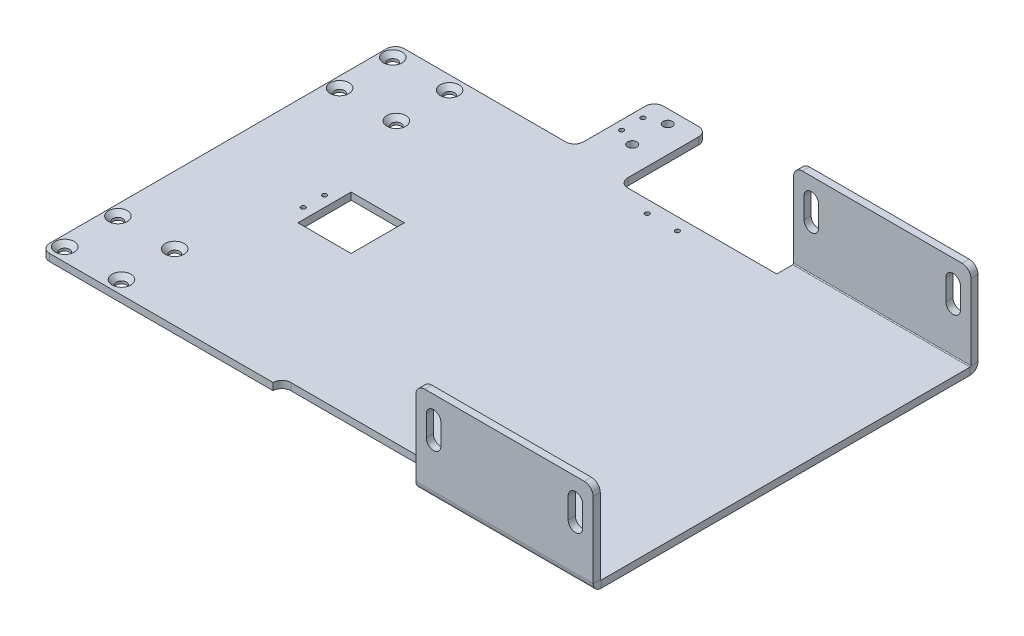
from build123d import *

# Parameters (mm, degrees)
SKETCH_1_W                  = 320
SKETCH_1_H                  = 200
SM_BASE_FLANGE_1_DEPTH      = 4
HOLE_WIZARD_1_AT_2_COUNT    = 2
HOLE_WIZARD_1_AT_2_PITCH    = 30
HOLE_WIZARD_1_AT_3_COUNT    = 2
HOLE_WIZARD_1_AT_3_PITCH    = 43.863424399
HOLE_WIZARD_1_AT_4_COUNT    = 2
HOLE_WIZARD_1_AT_4_PITCH    = 32
HOLE_WIZARD_1_AT_5_COUNT    = 2
HOLE_WIZARD_1_AT_5_PITCH    = 129.031004026
HOLE_WIZARD_1_AT_6_COUNT    = 2
HOLE_WIZARD_1_AT_6_PITCH    = 125
HOLE_WIZARD_1_AT_7_COUNT    = 2
HOLE_WIZARD_1_AT_7_PITCH    = 158.268758762
HOLE_WIZARD_1_AT_8_COUNT    = 2
HOLE_WIZARD_1_AT_8_PITCH    = 155
SKETCH_9_W                  = 30
SKETCH_9_H                  = 45
SM_BASE_FLANGE_1_2_DEPTH    = 4
SKETCH_27_W                 = 89
SKETCH_27_H                 = 5
CUT_EXTRUDE_2_DEPTH         = 216.965274987
SM_EDGE_FLANGE_1_DEPTH      = 100
SM_EDGE_FLANGE_1_BEND_DEPTH = 100
HOLE_START                  = -108.5
HOLE_WIZARD_8_2_8_2_1_DEPTH = 217
F_5_2_5_2_DIAMETER_HOLE1_D  = 5.2
CUT_EXTRUDE_1_REACH         = 223.199
SKETCH_21_W                 = 30
SKETCH_21_H                 = 30
HOLE_WIZARD_M3_2_D          = 2.5
OTHER_START                 = -108.5
OTHER_1_DEPTH               = 217
OTHER_START_2               = -4
OTHER_2_DEPTH               = 4
OTHER_2_2_DEPTH             = 4
HOLE_WIZARD_M3_1_D          = 2.5
HOLE_WIZARD_M3_3_D          = 2.5


# Read off the part's stored shape, not the designer's step: Ø8.2 (8.2) 直径槽口1, 断开-边角1, 断开-边角2
# Sheet-metal steps are written as plain solids
with BuildPart() as part:
    # Sketch 1 → Sm Base Flange 1 (new body)
    with BuildSketch(Plane(origin=(0, 0, 0), x_dir=(1, 0, 0), z_dir=(0, 1, 0))):
        Rectangle(SKETCH_1_W, SKETCH_1_H)
    extrude(amount=-SM_BASE_FLANGE_1_DEPTH)

    # 草图7 → 打孔尺寸开槽半沉头螺钉的类型1 (revolve, cut)
    with BuildSketch(Plane(origin=(-154, 0, 62.5), x_dir=(0, 0, 1), z_dir=(1, 0, 0))):
        Polygon((0, 0), (0, 4), (2.75, 4), (2.75, 2.55), (5.3, 0), align=None)
    hole_wizard_1 = revolve(axis=Axis((-154, 6.35, 62.5), (0, -1, 0)), mode=Mode.SUBTRACT)

    # 打孔尺寸开槽半沉头螺钉的类型1 at 2: 打孔尺寸开槽半沉头螺钉的类型1 ×2
    with Locations(*[(0, 0, i * HOLE_WIZARD_1_AT_2_PITCH) for i in range(1, HOLE_WIZARD_1_AT_2_COUNT)]):
        add(hole_wizard_1, mode=Mode.SUBTRACT)

    # 打孔尺寸开槽半沉头螺钉的类型1 at 3: 打孔尺寸开槽半沉头螺钉的类型1 ×2
    with Locations(*[Vector(0.7295372041400852, 0, 0.6839411288813297) * (i * HOLE_WIZARD_1_AT_3_PITCH) for i in range(1, HOLE_WIZARD_1_AT_3_COUNT)]):
        add(hole_wizard_1, mode=Mode.SUBTRACT)

    # 打孔尺寸开槽半沉头螺钉的类型1 at 4: 打孔尺寸开槽半沉头螺钉的类型1 ×2
    with Locations(*[(i * HOLE_WIZARD_1_AT_4_PITCH, 0, 0) for i in range(1, HOLE_WIZARD_1_AT_4_COUNT)]):
        add(hole_wizard_1, mode=Mode.SUBTRACT)

    # 打孔尺寸开槽半沉头螺钉的类型1 at 5: 打孔尺寸开槽半沉头螺钉的类型1 ×2
    with Locations(*[Vector(0.24800241028513723, 0, -0.9687594151763185) * (i * HOLE_WIZARD_1_AT_5_PITCH) for i in range(1, HOLE_WIZARD_1_AT_5_COUNT)]):
        add(hole_wizard_1, mode=Mode.SUBTRACT)

    # 打孔尺寸开槽半沉头螺钉的类型1 at 6: 打孔尺寸开槽半沉头螺钉的类型1 ×2
    with Locations(*[(0, 0, -i * HOLE_WIZARD_1_AT_6_PITCH) for i in range(1, HOLE_WIZARD_1_AT_6_COUNT)]):
        add(hole_wizard_1, mode=Mode.SUBTRACT)

    # 打孔尺寸开槽半沉头螺钉的类型1 at 7: 打孔尺寸开槽半沉头螺钉的类型1 ×2
    with Locations(*[Vector(0.20218772327747656, 0, -0.979346784625278) * (i * HOLE_WIZARD_1_AT_7_PITCH) for i in range(1, HOLE_WIZARD_1_AT_7_COUNT)]):
        add(hole_wizard_1, mode=Mode.SUBTRACT)

    # 打孔尺寸开槽半沉头螺钉的类型1 at 8: 打孔尺寸开槽半沉头螺钉的类型1 ×2
    with Locations(*[(0, 0, -i * HOLE_WIZARD_1_AT_8_PITCH) for i in range(1, HOLE_WIZARD_1_AT_8_COUNT)]):
        add(hole_wizard_1, mode=Mode.SUBTRACT)

    # 草图9 → Sm Base Flange 1 2 (add)
    with BuildSketch(Plane(origin=(0, 0, 0), x_dir=(1, 0, 0), z_dir=(0, 1, 0))):
        with Locations((-44, 122.5)):
            Rectangle(SKETCH_9_W, SKETCH_9_H)
    extrude(amount=-SM_BASE_FLANGE_1_2_DEPTH)

    # 草图27 → 切除-拉伸2 (cut, through all)
    with BuildSketch(Plane(origin=(0, 0, 0), x_dir=(1, 0, 0), z_dir=(0, 1, 0))):
        with Locations((15.5, 97.5)):
            Rectangle(SKETCH_27_W, SKETCH_27_H)
        with Locations((15.5, -97.5)):
            Rectangle(SKETCH_27_W, SKETCH_27_H)
    extrude(amount=-CUT_EXTRUDE_2_DEPTH, mode=Mode.SUBTRACT)

    # 边线-法兰1 section (across the edge) → 边线-法兰1 (add)
    with BuildSketch(Plane(origin=(60, 0, 104.5), x_dir=(0, 0, -1), z_dir=(1, 0, 0))):
        with BuildLine():
            Line((-4, 0.5), (-4, 48))
            Line((-4, 48), (0, 48))
            Line((0, 48), (0, 0.5))
            ThreePointArc((0, 0.5), (0.146446609, 0.146446609), (0.5, 0))
            Line((0.5, 0), (4.5, 0))
            Line((4.5, 0), (4.5, -4))
            Line((4.5, -4), (0.5, -4))
            ThreePointArc((0.5, -4), (-2.681980515, -2.681980515), (-4, 0.5))
        make_face()
    extrude(amount=SM_EDGE_FLANGE_1_DEPTH)

    # 边线-法兰1 section 2 (across the edge) → 边线-法兰1 bend (add)
    with BuildSketch(Plane(origin=(160, 0, -104.5), x_dir=(0, 0, 1), z_dir=(-1, 0, 0))):
        with BuildLine():
            Line((-4, 0.5), (-4, 48))
            Line((-4, 48), (0, 48))
            Line((0, 48), (0, 0.5))
            ThreePointArc((0, 0.5), (0.146446609, 0.146446609), (0.5, 0))
            Line((0.5, 0), (4.5, 0))
            Line((4.5, 0), (4.5, -4))
            Line((4.5, -4), (0.5, -4))
            ThreePointArc((0.5, -4), (-2.681980515, -2.681980515), (-4, 0.5))
        make_face()
    extrude(amount=SM_EDGE_FLANGE_1_BEND_DEPTH)

    # Ø8.2 (8.2) 直径槽口1 outline → Ø8.2 (8.2) 直径槽口1 (cut)
    with BuildSketch(Plane.XY.offset(HOLE_START)):
        with BuildLine():
            ThreePointArc((145.9, 24.6), (150, 20.5), (154.1, 24.6))
            Line((154.1, 24.6), (154.1, 36.4))
            ThreePointArc((154.1, 36.4), (150, 40.5), (145.9, 36.4))
            Line((145.9, 36.4), (145.9, 24.6))
        make_face()
        with BuildLine():
            ThreePointArc((65.9, 24.6), (70, 20.5), (74.1, 24.6))
            Line((74.1, 24.6), (74.1, 36.4))
            ThreePointArc((74.1, 36.4), (70, 40.5), (65.9, 36.4))
            Line((65.9, 36.4), (65.9, 24.6))
        make_face()
    extrude(amount=HOLE_WIZARD_8_2_8_2_1_DEPTH, mode=Mode.SUBTRACT)

    # Ø5.2 (5.2) Diameter Hole1 (through all)
    with Locations(Plane(origin=(0, 0, 0), x_dir=(1, 0, 0), z_dir=(0, 1, 0))):
        with Locations((-44, 117.5), (-44, 137.5)):
            Hole(F_5_2_5_2_DIAMETER_HOLE1_D / 2)

    # 草图21 → 切除-拉伸1 (cut, up to next)
    with BuildSketch(Plane(origin=(0, 0, 0), x_dir=(1, 0, 0), z_dir=(0, 1, 0)), mode=Mode.PRIVATE) as cut_extrude_1_sk1:
        with Locations((-85, 0)):
            Rectangle(SKETCH_21_W, SKETCH_21_H)
    cut_extrude_1_tool1 = extrude(cut_extrude_1_sk1.sketch, amount=-CUT_EXTRUDE_1_REACH, mode=Mode.PRIVATE) & part.part
    add(cut_extrude_1_tool1.solids().sort_by_distance((-85, 0, 0))[0], mode=Mode.SUBTRACT)

    # M3 螺纹孔2 (through all)
    with Locations(Plane(origin=(0, 0, 0), x_dir=(1, 0, 0), z_dir=(0, 1, 0))):
        with Locations((-106, 6), (-106, -6)):
            Hole(HOLE_WIZARD_M3_2_D / 2)

    # Other 1 outline → Other 1 (cut)
    with BuildSketch(Plane.XY.offset(OTHER_START)):
        with BuildLine():
            ThreePointArc((60, 43), (61.464466094, 46.535533906), (65, 48))
            Line((65, 48), (60, 48))
            Line((60, 48), (60, 43))
        make_face()
        with BuildLine():
            ThreePointArc((155, 48), (158.535533906, 46.535533906), (160, 43))
            Line((160, 43), (160, 48))
            Line((160, 48), (155, 48))
        make_face()
    extrude(amount=OTHER_1_DEPTH, mode=Mode.SUBTRACT)

    # Other 2 outline → Other 2 (cut)
    with BuildSketch(Plane(origin=(0, 0, 0), x_dir=(1, 0, 0), z_dir=(0, 1, 0)).offset(OTHER_START_2)):
        with BuildLine():
            Line((-29, 145), (-34, 145))
            ThreePointArc((-34, 145), (-30.464466094, 143.535533906), (-29, 140))
            Line((-29, 140), (-29, 145))
        make_face()
        with BuildLine():
            Line((-59, 145), (-59, 140))
            ThreePointArc((-59, 140), (-57.535533906, 143.535533906), (-54, 145))
            Line((-54, 145), (-59, 145))
        make_face()
        with BuildLine():
            Line((-160, 100), (-160, 95))
            ThreePointArc((-160, 95), (-158.535533906, 98.535533906), (-155, 100))
            Line((-155, 100), (-160, 100))
        make_face()
        with BuildLine():
            Line((-160, -100), (-155, -100))
            ThreePointArc((-155, -100), (-158.535533906, -98.535533906), (-160, -95))
            Line((-160, -95), (-160, -100))
        make_face()
    extrude(amount=OTHER_2_DEPTH, mode=Mode.SUBTRACT)

    # Other 2 2 outline → Other 2 2 (add)
    with BuildSketch(Plane(origin=(0, 0, 0), x_dir=(1, 0, 0), z_dir=(0, 1, 0)).offset(OTHER_START_2)):
        with BuildLine():
            Line((-29, -95), (-29, -100))
            ThreePointArc((-29, -100), (-27.535533906, -96.464466094), (-24, -95))
            Line((-24, -95), (-29, -95))
        make_face()
        with BuildLine():
            ThreePointArc((-24, 95), (-27.535533906, 96.464466094), (-29, 100))
            Line((-29, 100), (-29, 95))
            Line((-29, 95), (-24, 95))
        make_face()
        with BuildLine():
            ThreePointArc((-59, 105), (-60.464466094, 101.464466094), (-64, 100))
            Line((-64, 100), (-59, 100))
            Line((-59, 100), (-59, 105))
        make_face()
    extrude(amount=OTHER_2_2_DEPTH)

    # M3 螺纹孔1 (through all)
    with Locations(Plane(origin=(0, 0, 0), x_dir=(1, 0, 0), z_dir=(0, 1, 0))):
        with Locations((11, 88), (-6, 88)):
            Hole(HOLE_WIZARD_M3_1_D / 2)

    # M3 螺纹孔3 (through all)
    with Locations(Plane(origin=(0, 0, 0), x_dir=(1, 0, 0), z_dir=(0, 1, 0))):
        with Locations((-54, 133.5), (-54, 121.5)):
            Hole(HOLE_WIZARD_M3_3_D / 2)


solid = part.part
